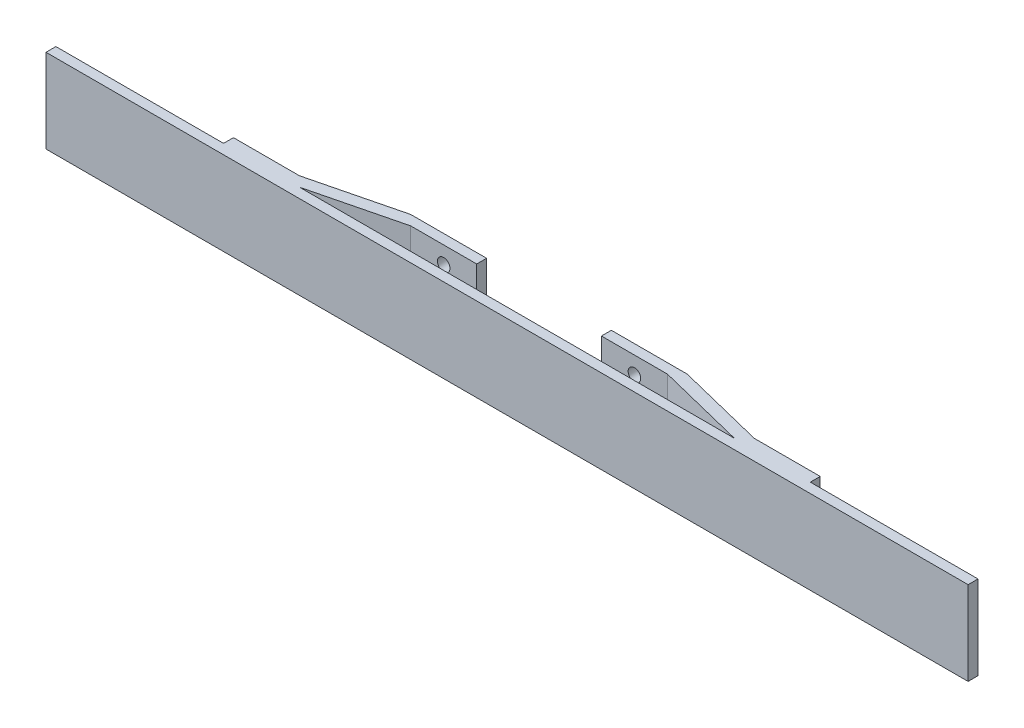
from build123d import *

# Parameters (mm, degrees)
SKETCH1_W                 = 304.8
SKETCH1_H                 = 25.4
BOSS_EXTRUDE2_DEPTH       = 12.7
FILLET1_R                 = 12.7
CUT_EXTRUDE3_DEPTH        = 281.209703849
SKETCH8_W                 = 70
SKETCH8_H                 = 25.4
BOSS_EXTRUDE3_DEPTH       = 9.7
CUT_EXTRUDE4_DEPTH        = 281.209703849
CUT_EXTRUDE5_DEPTH        = 281.209703849
SKETCH13_W                = 12.7
SKETCH13_H                = 25.4
CUT_EXTRUDE7_DEPTH        = 280.450243045
F_6_CLEARANCE_HOLE1_D     = 3.7973
F_6_CLEARANCE_HOLE1_DEPTH = 3


with BuildPart() as part:
    # Sketch1 → Boss-Extrude2 (new body)
    with BuildSketch(Plane.XY):
        with Locations((126.366978193, -2.136448598)):
            Rectangle(SKETCH1_W, SKETCH1_H)
    extrude(amount=BOSS_EXTRUDE2_DEPTH)

    # Fillet1
    fillet1_edges = [part.edges().sort_by_distance(p)[0] for p in [
        (-26.033021807, -2.136448598, 12.7),
        (278.766978193, -2.136448598, 12.7),
    ]]
    fillet(fillet1_edges, radius=FILLET1_R - 0.0001)  # a hair under: the kernel refuses the full size

    # Sketch6 → Cut-Extrude3 (cut, through all)
    with BuildSketch(Plane(origin=(0, 10.563551402, 0), x_dir=(1, 0, 0), z_dir=(0, 1, 0))):
        with BuildLine():
            Line((-23.033021807, 0), (275.766978193, 0))
            ThreePointArc((275.766978193, 0), (272.925913971, -6.858935778), (266.066978193, -9.7))
            Line((266.066978193, -9.7), (-13.333021807, -9.7))
            ThreePointArc((-13.333021807, -9.7), (-20.191957584, -6.858935778), (-23.033021807, 0))
        make_face()
    extrude(amount=-CUT_EXTRUDE3_DEPTH, mode=Mode.SUBTRACT)

    # Sketch8 → Boss-Extrude3 (add)
    with BuildSketch(Plane(origin=(0, 0, 9.7), x_dir=(-1, 0, 0), z_dir=(0, 0, -1))):
        with Locations((-180.266978193, -2.136448598)):
            Rectangle(SKETCH8_W, SKETCH8_H)
        with Locations((-72.466978193, -2.136448598)):
            Rectangle(SKETCH8_W, SKETCH8_H)
    extrude(amount=BOSS_EXTRUDE3_DEPTH)

    # Sketch9 → Cut-Extrude4 (cut, through all)
    with BuildSketch(Plane(origin=(0, 10.563551402, 0), x_dir=(1, 0, 0), z_dir=(0, 1, 0))):
        Polygon((145.266978193, -9.7), (165.266978193, -9.7), (192.266978193, -9.7), (165.266978193, -3), (145.266978193, -3), align=None)
        Polygon((215.266978193, -6.7), (195.266978193, -6.7), (168.266978193, 0), (215.266978193, 0), align=None)
    extrude(amount=-CUT_EXTRUDE4_DEPTH, mode=Mode.SUBTRACT)

    # Sketch12 → Cut-Extrude5 (cut, through all)
    with BuildSketch(Plane(origin=(0, 10.563551402, 0), x_dir=(1, 0, 0), z_dir=(0, 1, 0))):
        Polygon((107.466978193, -9.7), (107.466978193, -3), (87.466978193, -3), (60.466978193, -9.7), align=None)
        Polygon((37.466978193, -6.7), (57.466978193, -6.7), (84.466978193, 0), (37.466978193, 0), align=None)
    extrude(amount=-CUT_EXTRUDE5_DEPTH, mode=Mode.SUBTRACT)

    # Sketch13 → Cut-Extrude7 (cut, through all)
    with BuildSketch(Plane.XY.offset(12.7)):
        with Locations((-19.683021807, -2.136448598)):
            Rectangle(SKETCH13_W, SKETCH13_H)
        with Locations((272.416978193, -2.136448598)):
            Rectangle(SKETCH13_W, SKETCH13_H)
    extrude(amount=-CUT_EXTRUDE7_DEPTH, mode=Mode.SUBTRACT)

    # #6 Clearance Hole1
    with Locations(Plane.XY.offset(3)):
        with Locations((97.466978193, 5.363551402), (97.466978193, -9.636448598), (155.266978193, -9.636448598), (155.266978193, 5.363551402)):
            Hole(F_6_CLEARANCE_HOLE1_D / 2, depth=F_6_CLEARANCE_HOLE1_DEPTH)


solid = part.part
